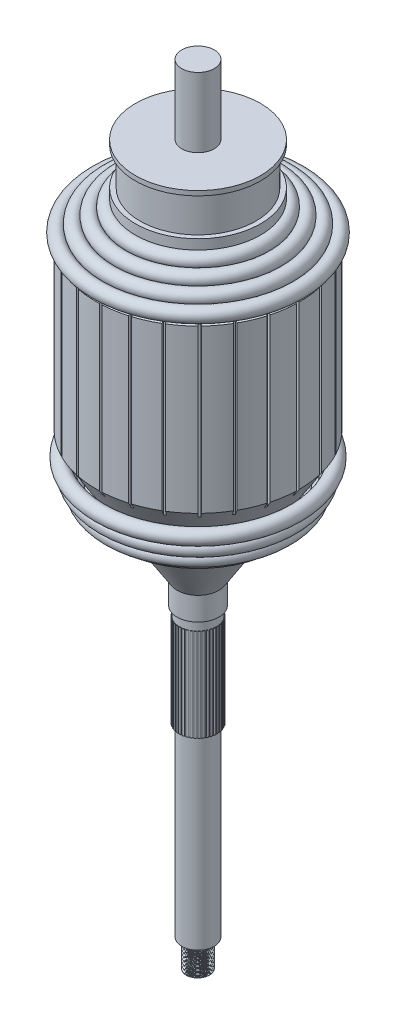
from build123d import *
from build123d.topology import SkipClean

# Parameters (mm, degrees)
CUT_EXTRUDE2_START  = 100
CUT_EXTRUDE2_DEPTH  = 100
SKETCH3_W           = 0.2
SKETCH3_H           = 0.09
BOSS_EXTRUDE1_DEPTH = 20
SKETCH4_W           = 0.373587109
SKETCH4_H           = 0.148348787
BOSS_EXTRUDE2_DEPTH = 20
THREAD1_PITCH       = 0.25
SKETCH5_R           = 1.5


with BuildPart() as part:
    # Sketch1 → Revolve1 (revolve)
    with BuildSketch(Plane.XY, mode=Mode.PRIVATE) as revolve1_sk:
        Polygon((0, 170), (3.5, 170), (3.5, 155), (13.5, 155), (13.5, 154), (12.5, 154), (12.5, 146), (13.5, 146), (13.5, 141), (21.95690767, 135.663267605), (21.95690767, 100.663267605), (4.5, 73), (4.5, 68), (4, 68), (4, 46), (3.5, 46), (3.5, 6), (2.5, 6), (2.5, 0), (0, 0), align=None)
    revolve(revolve1_sk.sketch.rotate(Axis((0, 0, 0), (0, 1, 0)), 90), axis=Axis((0, 0, 0), (0, 1, 0)))

    # Sketch2 → Cut-Extrude2 (cut)
    with BuildSketch(Plane(origin=(0, 180, 0), x_dir=(-1, 0, 0), z_dir=(0, -1, 0)).offset(CUT_EXTRUDE2_START)):
        with BuildLine():
            Line((-20.518018535, 5.08710499), (-21.311651247, 5.283873159))
            ThreePointArc((-21.311651247, 5.283873159), (-21.373157412, 5.029307774), (-21.431622935, 4.774026896))
            Line((-21.431622935, 4.774026896), (-20.633522551, 4.596245087))
            ThreePointArc((-20.633522551, 4.596245087), (-20.577234248, 4.842019463), (-20.518018535, 5.08710499))
        make_face()
        with BuildLine():
            Line((-18.842242826, 9.583193991), (-19.57105688, 9.953869952))
            ThreePointArc((-19.57105688, 9.953869952), (-19.450942387, 10.186590927), (-19.328060714, 10.417862711))
            Line((-19.328060714, 10.417862711), (-18.608295687, 10.029907947))
            ThreePointArc((-18.608295687, 10.029907947), (-18.726601322, 9.807248581), (-18.842242826, 9.583193991))
        make_face()
        with BuildLine():
            Line((-15.867035687, 13.967995572), (-16.480769345, 14.508274751))
            ThreePointArc((-16.480769345, 14.508274751), (-16.306553116, 14.703813109), (-16.130017043, 14.897259635))
            Line((-16.130017043, 14.897259635), (-15.529345184, 14.342494899))
            ThreePointArc((-15.529345184, 14.342494899), (-15.699307162, 14.156252202), (-15.867035687, 13.967995572))
        make_face()
        with BuildLine():
            Line((-11.89484434, 17.47513662), (-12.354934459, 18.15107129))
            ThreePointArc((-12.354934459, 18.15107129), (-12.137563141, 18.297140636), (-11.918465079, 18.440606948))
            Line((-11.918465079, 18.440606948), (-11.47462881, 17.75389015))
            ThreePointArc((-11.47462881, 17.75389015), (-11.685567796, 17.615766434), (-11.89484434, 17.47513662))
        make_face()
        with BuildLine():
            Line((-7.175256178, 19.884250566), (-7.452793603, 20.653369264))
            ThreePointArc((-7.452793603, 20.653369264), (-7.205925435, 20.740791525), (-6.958032121, 20.825263106))
            Line((-6.958032121, 20.825263106), (-6.698919308, 20.049743188))
            ThreePointArc((-6.698919308, 20.049743188), (-6.937581229, 19.968417275), (-7.175256178, 19.884250566))
        make_face()
        with BuildLine():
            Line((-2.004820281, 21.043963919), (-2.082366315, 21.85794009))
            ThreePointArc((-2.082366315, 21.85794009), (-1.821512933, 21.881222203), (-1.560400415, 21.901391394))
            Line((-1.560400415, 21.901391394), (-1.502292068, 21.085797123))
            ThreePointArc((-1.502292068, 21.085797123), (-1.753680918, 21.06637902), (-2.004820281, 21.043963919))
        make_face()
        with BuildLine():
            Line((3.291585847, 20.881407625), (3.418903706, 21.689096152))
            ThreePointArc((3.418903706, 21.689096152), (3.677351926, 21.646775216), (3.935276988, 21.601374712))
            Line((3.935276988, 21.601374712), (3.788729707, 20.796952877))
            ThreePointArc((3.788729707, 20.796952877), (3.540409614, 20.840662694), (3.291585847, 20.881407625))
        make_face()
        with BuildLine():
            Line((8.381169531, 19.406795693), (8.705351434, 20.157446536))
            ThreePointArc((8.705351434, 20.157446536), (8.945155239, 20.052181732), (9.183686465, 19.944064214))
            Line((9.183686465, 19.944064214), (8.841691661, 19.201359596))
            ThreePointArc((8.841691661, 19.201359596), (8.61204319, 19.305450885), (8.381169531, 19.406795693))
        make_face()
        with BuildLine():
            Line((12.944133509, 16.712783415), (13.444809916, 17.35923042))
            ThreePointArc((13.444809916, 17.35923042), (13.65090155, 17.197635922), (13.855051146, 17.033594811))
            Line((13.855051146, 17.033594811), (13.33909761, 16.399274274))
            ThreePointArc((13.33909761, 16.399274274), (13.142550419, 16.557206596), (12.944133509, 16.712783415))
        make_face()
        with BuildLine():
            Line((16.693769974, 12.968645489), (17.339481543, 13.470270014))
            ThreePointArc((17.339481543, 13.470270014), (17.498911513, 13.262499399), (17.655852008, 13.052842001))
            Line((17.655852008, 13.052842001), (16.998358999, 12.566762237))
            ThreePointArc((16.998358999, 12.566762237), (16.84726287, 12.768612124), (16.693769974, 12.968645489))
        make_face()
        with BuildLine():
            Line((19.394475476, 8.409639873), (20.144649775, 8.734923003))
            ThreePointArc((20.144649775, 8.734923003), (20.247400508, 8.494031263), (20.347270755, 8.251931123))
            Line((20.347270755, 8.251931123), (19.589550976, 7.944634312))
            ThreePointArc((19.589550976, 7.944634312), (19.493399835, 8.177718792), (19.394475476, 8.409639873))
        make_face()
        with BuildLine():
            Line((20.876554756, 3.322225654), (21.684055575, 3.450728655))
            ThreePointArc((21.684055575, 3.450728655), (21.723670865, 3.191851904), (21.760195648, 2.932521065))
            Line((21.760195648, 2.932521065), (20.94985942, 2.823315794))
            ThreePointArc((20.94985942, 2.823315794), (20.914694797, 3.072989313), (20.876554756, 3.322225654))
        make_face()
        with BuildLine():
            Line((21.046883322, -1.973936221), (21.860972415, -2.050287665))
            ThreePointArc((21.860972415, -2.050287665), (21.834963088, -2.31088325), (21.80584742, -2.571150077))
            Line((21.80584742, -2.571150077), (20.993811148, -2.475402039))
            ThreePointArc((20.993811148, -2.475402039), (21.021842566, -2.224827387), (21.046883322, -1.973936221))
        make_face()
        with BuildLine():
            Line((19.894758804, -7.146068423), (20.664283959, -7.422476871))
            ThreePointArc((20.664283959, -7.422476871), (20.574284276, -7.66841711), (20.481357603, -7.913266404))
            Line((20.481357603, -7.913266404), (19.718644512, -7.618581257))
            ThreePointArc((19.718644512, -7.618581257), (19.808110654, -7.382849999), (19.894758804, -7.146068423))
        make_face()
        with BuildLine():
            Line((17.492573422, -11.869186865), (18.169182544, -12.328284558))
            ThreePointArc((18.169182544, -12.328284558), (18.020847516, -12.54411612), (17.869948762, -12.7581631))
            Line((17.869948762, -12.7581631), (17.204482922, -12.283056996))
            ThreePointArc((17.204482922, -12.283056996), (17.3497623, -12.076980994), (17.492573422, -11.869186865))
        make_face()
        with BuildLine():
            Line((13.99126532, -15.846520644), (14.532444568, -16.459460785))
            ThreePointArc((14.532444568, -16.459460785), (14.335094631, -16.631622181), (14.135705319, -16.801417487))
            Line((14.135705319, -16.801417487), (13.609300395, -16.17574309))
            ThreePointArc((13.609300395, -16.17574309), (13.801264573, -16.012270856), (13.99126532, -15.846520644))
        make_face()
        with BuildLine():
            Line((9.61083456, -18.828159252), (9.982579653, -19.556428557))
            ThreePointArc((9.982579653, -19.556428557), (9.74861503, -19.674102253), (9.513263524, -19.788977022))
            Line((9.513263524, -19.788977022), (9.158995474, -19.052047756))
            ThreePointArc((9.158995474, -19.052047756), (9.385582635, -18.941450852), (9.61083456, -18.828159252))
        make_face()
        with BuildLine():
            Line((4.62651972, -20.626755369), (4.805472545, -21.424594))
            ThreePointArc((4.805472545, -21.424594), (4.549594093, -21.480386124), (4.293068394, -21.533122352))
            Line((4.293068394, -21.533122352), (4.133197182, -20.731242192))
            ThreePointArc((4.133197182, -20.731242192), (4.380170022, -20.680469829), (4.62651972, -20.626755369))
        make_face()
        with BuildLine():
            Line((-0.64849637, -21.129296586), (-0.673580076, -21.946573407))
            ThreePointArc((-0.673580076, -21.946573407), (-0.935294573, -21.936978336), (-1.196876012, -21.924262411))
            Line((-1.196876012, -21.924262411), (-1.152305089, -21.107816437))
            ThreePointArc((-1.152305089, -21.107816437), (-0.900464782, -21.120058829), (-0.64849637, -21.129296586))
        make_face()
        with BuildLine():
            Line((-5.882765048, -20.304206391), (-6.110309183, -21.089568894))
            ThreePointArc((-6.110309183, -21.089568894), (-6.361415242, -21.01518952), (-6.611616296, -20.937820431))
            Line((-6.611616296, -20.937820431), (-6.365403794, -20.158108947))
            ThreePointArc((-6.365403794, -20.158108947), (-6.124520072, -20.232596859), (-5.882765048, -20.304206391))
        make_face()
        with BuildLine():
            Line((-10.747397963, -18.203328234), (-11.163105093, -18.907429205))
            ThreePointArc((-11.163105093, -18.907429205), (-11.387824794, -18.772939059), (-11.610924413, -18.635778189))
            Line((-11.610924413, -18.635778189), (-11.178540768, -17.941793335))
            ThreePointArc((-11.178540768, -17.941793335), (-10.963749242, -18.073846418), (-10.747397963, -18.203328234))
        make_face()
        with BuildLine():
            Line((-14.936732337, -14.958668017), (-15.514482054, -15.537266202))
            ThreePointArc((-15.514482054, -15.537266202), (-15.698695434, -15.351115794), (-15.880675446, -15.162781467))
            Line((-15.880675446, -15.162781467), (-15.289288914, -14.598128862))
            ThreePointArc((-15.289288914, -14.598128862), (-15.114085725, -14.779449735), (-14.936732337, -14.958668017))
        make_face()
        with BuildLine():
            Line((-18.187536886, -10.774099675), (-18.89102705, -11.190839622))
            ThreePointArc((-18.89102705, -11.190839622), (-19.023159304, -10.964725466), (-19.152585237, -10.73705142))
            Line((-19.152585237, -10.73705142), (-18.439354807, -10.337210265))
            ThreePointArc((-18.439354807, -10.337210265), (-18.314748616, -10.556405871), (-18.187536886, -10.774099675))
        make_face()
        with BuildLine():
            Line((-20.295551602, -5.912555026), (-21.08057934, -6.141251431))
            ThreePointArc((-21.08057934, -6.141251431), (-21.152328112, -5.889381112), (-21.221067659, -5.636672944))
            Line((-21.221067659, -5.636672944), (-20.430808223, -5.426766729))
            ThreePointArc((-20.430808223, -5.426766729), (-20.364628495, -5.670064202), (-20.295551602, -5.912555026))
        make_face()
        with BuildLine():
            Line((-21.12832217, -0.679502799), (-21.945561301, -0.705785827))
            ThreePointArc((-21.945561301, -0.705785827), (-21.952418352, -0.443985283), (-21.956152354, -0.182121577))
            Line((-21.956152354, -0.182121577), (-21.138518819, -0.175339482))
            ThreePointArc((-21.138518819, -0.175339482), (-21.134923869, -0.427451546), (-21.12832217, -0.679502799))
        make_face()
    extrude(amount=-CUT_EXTRUDE2_DEPTH, mode=Mode.SUBTRACT)

    # Sketch3 → Boss-Extrude1 (add)
    with BuildSketch(Plane.XZ.offset(-46)):
        Polygon((-0.031634172, 3.915857211), (0.166788768, 3.890790564), (0.178068759, 3.980080888), (-0.020354181, 4.005147534), align=None)
        with Locations((-0.421844554, 3.920813695)):
            Rectangle(SKETCH3_W, SKETCH3_H)
        Polygon((0.459729539, 3.89414532), (0.653446171, 3.844407343), (0.675828261, 3.931579827), (0.482111628, 3.981317805), align=None)
        Polygon((0.944497478, 3.811020431), (1.130452775, 3.737395521), (1.163583985, 3.821075404), (0.977628688, 3.894700315), align=None)
        Polygon((1.415024566, 3.667793474), (1.590285902, 3.571442739), (1.633643733, 3.65031034), (1.458382397, 3.746661075), align=None)
        Polygon((1.86389031, 3.466723222), (2.025693709, 3.349166171), (2.078594382, 3.421977701), (1.916790983, 3.539534751), align=None)
        Polygon((2.284015829, 3.210980674), (2.429809554, 3.074071253), (2.491418794, 3.139678429), (2.345625068, 3.27658785), align=None)
        Polygon((2.668775492, 2.904599042), (2.79626029, 2.750496394), (2.865606482, 2.807864553), (2.738121684, 2.961967202), align=None)
        Polygon((3.012101409, 2.552410149), (3.119266768, 2.383544564), (3.195256281, 2.431768976), (3.088090922, 2.600634561), align=None)
        Polygon((3.308579126, 2.159968223), (3.393734985, 1.979002812), (3.475169419, 2.017322949), (3.390013561, 2.198288359), align=None)
        Polygon((3.553533013, 1.733462308), (3.615336412, 1.543251004), (3.700931498, 1.571062534), (3.639128099, 1.761273837), align=None)
        Polygon((3.743099999, 1.279618656), (3.780576262, 1.083161206), (3.868982114, 1.100025524), (3.831505852, 1.296482975), align=None)
        Polygon((3.874290501, 0.805594654), (3.886848604, 0.605989309), (3.97667101, 0.611640455), (3.964112906, 0.811245801), align=None)
        Polygon((3.945035565, 0.318865943), (3.932477461, 0.119260598), (4.022299867, 0.113609451), (4.03485797, 0.313214796), align=None)
        Polygon((3.9542195, -0.172891474), (3.916743237, -0.369348924), (4.00514909, -0.386213243), (4.042625353, -0.189755792), align=None)
        Polygon((3.90169747, -0.66192229), (3.839894071, -0.852133593), (3.925489157, -0.879945122), (3.987292556, -0.689733819), align=None)
        Polygon((3.788297778, -1.140514195), (3.70314192, -1.321479606), (3.784576355, -1.359799742), (3.869732213, -1.178834332), align=None)
        Polygon((3.615808806, -1.601119511), (3.508643447, -1.769985096), (3.58463296, -1.818209507), (3.691798319, -1.649343922), align=None)
        Polygon((3.386950807, -2.036474215), (3.259466009, -2.190576864), (3.328812201, -2.247945023), (3.456296999, -2.093842374), align=None)
        Polygon((3.105333009, -2.439712505), (2.959539283, -2.576621926), (3.021148523, -2.642229102), (3.166942248, -2.505319681), align=None)
        Polygon((2.775396693, -2.80447507), (2.613593294, -2.922032121), (2.666493966, -2.99484365), (2.828297365, -2.8772866), align=None)
        Polygon((2.402345151, -3.125009389), (2.227083815, -3.221360124), (2.270441646, -3.300227725), (2.445702982, -3.20387699), align=None)
        Polygon((1.992061629, -3.396260443), (1.806106332, -3.469885353), (1.839237542, -3.553565237), (2.025192839, -3.479940326), align=None)
        Polygon((1.551016544, -3.613950441), (1.357299912, -3.663688418), (1.379682002, -3.750860902), (1.573398634, -3.701122925), align=None)
        Polygon((1.08616544, -3.774646281), (0.8877425, -3.799712928), (0.899022491, -3.889003251), (1.097445431, -3.863936604), align=None)
        with Locations((0.504839296, -3.920813695)):
            Rectangle(SKETCH3_W, SKETCH3_H)
        Polygon((0.114628914, -3.915857211), (-0.083794026, -3.890790564), (-0.095074017, -3.980080888), (0.103348923, -4.005147534), align=None)
        Polygon((-0.376734797, -3.89414532), (-0.570451429, -3.844407343), (-0.592833519, -3.931579827), (-0.399116886, -3.981317805), align=None)
        Polygon((-0.861502736, -3.811020431), (-1.047458033, -3.737395521), (-1.080589243, -3.821075404), (-0.894633946, -3.894700315), align=None)
        Polygon((-1.332029824, -3.667793474), (-1.50729116, -3.571442739), (-1.550648991, -3.65031034), (-1.375387655, -3.746661075), align=None)
        Polygon((-1.780895568, -3.466723222), (-1.942698967, -3.349166171), (-1.99559964, -3.421977701), (-1.833796241, -3.539534751), align=None)
        Polygon((-2.201021087, -3.210980674), (-2.346814812, -3.074071253), (-2.408424052, -3.139678429), (-2.262630326, -3.27658785), align=None)
        Polygon((-2.58578075, -2.904599042), (-2.713265548, -2.750496394), (-2.782611739, -2.807864553), (-2.655126942, -2.961967202), align=None)
        Polygon((-2.929106667, -2.552410149), (-3.036272026, -2.383544564), (-3.112261539, -2.431768976), (-3.00509618, -2.600634561), align=None)
        Polygon((-3.225584384, -2.159968223), (-3.310740243, -1.979002812), (-3.392174677, -2.017322949), (-3.307018819, -2.198288359), align=None)
        Polygon((-3.470538271, -1.733462308), (-3.53234167, -1.543251004), (-3.617936756, -1.571062534), (-3.556133357, -1.761273837), align=None)
        Polygon((-3.660105257, -1.279618656), (-3.69758152, -1.083161206), (-3.785987372, -1.100025524), (-3.74851111, -1.296482975), align=None)
        Polygon((-3.791295759, -0.805594654), (-3.803853862, -0.605989309), (-3.893676268, -0.611640455), (-3.881118164, -0.811245801), align=None)
        Polygon((-3.862040823, -0.318865943), (-3.849482719, -0.119260598), (-3.939305125, -0.113609451), (-3.951863228, -0.313214796), align=None)
        Polygon((-3.871224758, 0.172891474), (-3.833748495, 0.369348924), (-3.922154348, 0.386213243), (-3.959630611, 0.189755792), align=None)
        Polygon((-3.818702728, 0.66192229), (-3.756899329, 0.852133593), (-3.842494415, 0.879945122), (-3.904297814, 0.689733819), align=None)
        Polygon((-3.705303036, 1.140514195), (-3.620147178, 1.321479606), (-3.701581613, 1.359799742), (-3.786737471, 1.178834332), align=None)
        Polygon((-3.532814064, 1.601119511), (-3.425648705, 1.769985096), (-3.501638218, 1.818209507), (-3.608803577, 1.649343922), align=None)
        Polygon((-3.303956065, 2.036474215), (-3.176471267, 2.190576864), (-3.245817459, 2.247945023), (-3.373302257, 2.093842374), align=None)
        Polygon((-3.022338267, 2.439712505), (-2.876544541, 2.576621926), (-2.938153781, 2.642229102), (-3.083947506, 2.505319681), align=None)
        Polygon((-2.692401951, 2.80447507), (-2.530598552, 2.922032121), (-2.583499224, 2.99484365), (-2.745302623, 2.8772866), align=None)
        Polygon((-2.319350409, 3.125009389), (-2.144089073, 3.221360124), (-2.187446903, 3.300227725), (-2.36270824, 3.20387699), align=None)
        Polygon((-1.909066887, 3.396260443), (-1.72311159, 3.469885353), (-1.7562428, 3.553565237), (-1.942198097, 3.479940326), align=None)
        Polygon((-1.468021802, 3.613950441), (-1.27430517, 3.663688418), (-1.29668726, 3.750860902), (-1.490403892, 3.701122925), align=None)
        Polygon((-1.003170698, 3.774646281), (-0.804747758, 3.799712928), (-0.816027749, 3.889003251), (-1.014450689, 3.863936604), align=None)
    extrude(amount=-BOSS_EXTRUDE1_DEPTH)

    # Sketch4 → Boss-Extrude2 (add)
    with BuildSketch(Plane.XZ.offset(-46)):
        Polygon((0.090718378, 4.146030918), (0.459927205, 4.089003113), (0.437281869, 3.942392911), (0.068073041, 3.999420716), align=None)
        with Locations((-0.356439901, 4.037114895)):
            Rectangle(SKETCH4_W, SKETCH4_H)
        Polygon((0.722543849, 4.083593097), (1.078720451, 3.970874171), (1.033960566, 3.829438972), (0.677783964, 3.942157899), align=None)
        Polygon((1.337433504, 3.925439315), (1.672229405, 3.759671304), (1.606404105, 3.62672623), (1.271608204, 3.792494242), align=None)
        Polygon((1.920974852, 3.675276563), (2.226542718, 3.460344928), (2.141194892, 3.339006099), (1.835627027, 3.553937734), align=None)
        Polygon((2.459490178, 3.338968443), (2.728667757, 3.079910999), (2.625797887, 2.973022495), (2.356620307, 3.232079938), align=None)
        Polygon((2.940357138, 2.924397733), (3.166835137, 2.627286567), (3.048854404, 2.537353763), (2.822376405, 2.834464928), align=None)
        Polygon((3.352304619, 2.441281618), (3.530774585, 2.113080765), (3.400448358, 2.04221161), (3.221978392, 2.370412462), align=None)
        Polygon((3.685676921, 1.900943932), (3.81195567, 1.549346141), (3.672338685, 1.499201747), (3.546059936, 1.850799538), align=None)
        Polygon((3.93266008, 1.31604973), (4.003787744, 0.949296157), (3.858152505, 0.921051866), (3.787024841, 1.28780544), align=None)
        Polygon((4.08746502, 0.700308439), (4.101774427, 0.326995475), (3.953534501, 0.321313311), (3.939225094, 0.694626275), align=None)
        Polygon((4.146463244, 0.068152511), (4.103618994, -0.302969704), (3.956248999, -0.285956557), (3.999093249, 0.085165658), align=None)
        Polygon((4.108271884, -0.565600853), (4.00927821, -0.92583353), (3.866232374, -0.886523845), (3.965226047, -0.526291169), align=None)
        Polygon((3.973786113, -1.186097013), (3.820963343, -1.526996602), (3.685594538, -1.466311766), (3.838417308, -1.125412177), align=None)
        Polygon((3.746158164, -1.778792065), (3.543088334, -2.092368168), (3.418569491, -2.011730582), (3.621639321, -1.698154478), align=None)
        Polygon((3.430723442, -2.329793738), (3.182166337, -2.608696398), (3.071416072, -2.509996138), (3.319973177, -2.231093477), align=None)
        Polygon((3.034875471, -2.82618702), (2.746657058, -3.063878996), (2.652271263, -2.949429511), (2.940489676, -2.711737536), align=None)
        Polygon((2.56789259, -3.256336875), (2.246768465, -3.447246866), (2.170959464, -3.319730757), (2.492083589, -3.128820766), align=None)
        Polygon((2.040720484, -3.610160952), (1.694217524, -3.749814192), (1.638762215, -3.612220328), (1.985265175, -3.472567088), align=None)
        Polygon((1.46571562, -3.879365917), (1.101955561, -3.964489051), (1.068153769, -3.820042516), (1.431913828, -3.734919382), align=None)
        Polygon((0.856355624, -4.057641833), (0.483864693, -4.086239647), (0.472508704, -3.938326144), (0.844999635, -3.90972833), align=None)
        Polygon((0.226923377, -4.140810063), (-0.145567554, -4.112212249), (-0.134211565, -3.964298746), (0.238279366, -3.992896561), align=None)
        Polygon((-0.407827761, -4.126921215), (-0.77158782, -4.041798081), (-0.737786028, -3.897351546), (-0.374025969, -3.98247468), align=None)
        Polygon((-1.033019762, -4.016300831), (-1.379522722, -3.876647592), (-1.324067413, -3.739053728), (-0.977564453, -3.878706968), align=None)
        Polygon((-1.633998655, -3.81154176), (-1.95512278, -3.620631769), (-1.879313779, -3.49311566), (-1.558189654, -3.684025652), align=None)
        Polygon((-2.196678005, -3.517443381), (-2.484896418, -3.279751406), (-2.390510623, -3.165301922), (-2.10229221, -3.402993897), align=None)
        Polygon((-2.707869084, -3.14089911), (-2.956426189, -2.86199645), (-2.845675924, -2.763296189), (-2.597118819, -3.04219885), align=None)
        Polygon((-3.155590007, -2.690734826), (-3.358659837, -2.377158723), (-3.234140994, -2.296521136), (-3.031071164, -2.61009724), align=None)
        Polygon((-3.529346574, -2.177501999), (-3.682169344, -1.83660241), (-3.546800539, -1.775917574), (-3.39397777, -2.116817162), align=None)
        Polygon((-3.82037825, -1.61323037), (-3.919371923, -1.252997693), (-3.776326087, -1.213688009), (-3.677332413, -1.573920685), align=None)
        Polygon((-4.021863497, -1.011145988), (-4.064707746, -0.640023773), (-3.917337751, -0.623010625), (-3.874493502, -0.994132841), align=None)
        Polygon((-4.129079672, -0.385361202), (-4.114770265, -0.012048237), (-3.966530339, -0.017730401), (-3.980839746, -0.391043366), align=None)
        Polygon((-4.13951372, 0.249456125), (-4.068386056, 0.616209699), (-3.922750817, 0.587965409), (-3.993878481, 0.221211835), align=None)
        Polygon((-4.052921075, 0.878426411), (-3.926642326, 1.230024202), (-3.787025341, 1.179879808), (-3.91330409, 0.828282017), align=None)
        Polygon((-3.871331394, 1.486807127), (-3.692861428, 1.81500798), (-3.562535201, 1.744138824), (-3.741005167, 1.415937971), align=None)
        Polygon((-3.599000987, 2.060338344), (-3.372522988, 2.357449509), (-3.254542255, 2.267516704), (-3.481020254, 1.970405539), align=None)
        Polygon((-3.242313047, 2.585576976), (-2.973135468, 2.84463442), (-2.870265597, 2.737745915), (-3.139443177, 2.478688472), align=None)
        Polygon((-2.809628038, 3.050211876), (-2.504060172, 3.265143511), (-2.418712346, 3.143804682), (-2.724280212, 2.928873047), align=None)
        Polygon((-2.311087728, 3.443352394), (-1.976291828, 3.609120406), (-1.910466528, 3.476175332), (-2.245262429, 3.31040732), align=None)
        Polygon((-1.758377481, 3.755783651), (-1.402200879, 3.868502577), (-1.357440994, 3.727067378), (-1.713617596, 3.614348452), align=None)
        Polygon((-1.164452356, 3.980182522), (-0.795243529, 4.037210327), (-0.772598193, 3.890600124), (-1.14180702, 3.833572319), align=None)
    extrude(amount=-BOSS_EXTRUDE2_DEPTH)

    # Thread1: the profile of Thread Profile1 profile screwed along a right-hand helix of 24 turns, 6 arcs to a turn; built about Z, then put on its axis
    with SkipClean():  # the faces are left unmerged after this step: merging them gives an invalid solid
        thread1_z = Axis((0, 0, 0), (0, 0, 1))
        thread1_corners = [(2.5003, 0, -0.000173205), (2.5003, 0, 0.218923204), (2.364683531, 0, 0.140625), (2.364683531, 0, 0.078125)]
        with BuildLine(mode=Mode.PRIVATE) as thread1_profile:
            Line(thread1_corners[0], thread1_corners[1])
            Line(thread1_corners[1], thread1_corners[2])
            Line(thread1_corners[2], thread1_corners[3])
            Line(thread1_corners[3], thread1_corners[0])
        thread1_cap = Face(thread1_profile.wire())
        thread1_turn_angles = [0, 30, 60, 90, 120, 150, 180, 210, 240, 270, 300, 330, 360]
        thread1_turn_weights = [1, 0.8660254037844387, 1, 0.8660254037844387, 1, 0.8660254037844387, 1, 0.8660254037844387, 1, 0.8660254037844387, 1, 0.8660254037844387, 1]
        thread1_turn_rails = [Edge.make_bspline([Vector(p[0], p[1], 0).rotate(thread1_z, thread1_turn_angles[k]) / thread1_turn_weights[k] + Vector(0, 0, p[2] + THREAD1_PITCH * thread1_turn_angles[k] / 360) for k in range(13)], [0, 0, 0, 1, 1, 2, 2, 3, 3, 4, 4, 5, 5, 6, 6, 6], 2, thread1_turn_weights) for p in thread1_corners]
        thread1_turn_sides = [Face.make_surface_from_curves(thread1_turn_rails[p[0]], thread1_turn_rails[p[1]]) for p in [(0, 1), (1, 2), (2, 3), (3, 0)]]
        thread1 = Plane(origin=(0, 6, 0), x_dir=(-1, 0, 0), z_dir=(0, -1, 0)) * Solid(Shell([*[p.moved(Location((0, 0, THREAD1_PITCH * i))) for i in range(24) for p in thread1_turn_sides], thread1_cap, thread1_cap.rotate(thread1_z, 8640).moved(Location((0, 0, THREAD1_PITCH * 8640 / 360)))]))
        add(thread1, mode=Mode.SUBTRACT)


with BuildPart() as body_2:
    # Sketch5 → Revolve2 (revolve)
    with BuildSketch(Plane(origin=(0, 0, 0), x_dir=(0, 0, -1), z_dir=(1, 0, 0)), mode=Mode.PRIVATE) as revolve2_sk:
        with Locations((21.598295846, 137.663267605)):
            Circle(SKETCH5_R)
        with Locations((19.061223545, 139.264287324)):
            Circle(SKETCH5_R)
        with Locations((16.524151244, 140.865307042)):
            Circle(SKETCH5_R)
        with Locations((13.987078943, 142.466326761)):
            Circle(SKETCH5_R)
        with Locations((21.106842858, 95.742884868)):
            Circle(SKETCH5_R)
        with Locations((20.051319764, 92.934705565)):
            Circle(SKETCH5_R)
        with Locations((18.813729364, 90.201873701)):
            Circle(SKETCH5_R)
        with Locations((16.480384316, 88.316270113)):
            Circle(SKETCH5_R)
    revolve(revolve2_sk.sketch.rotate(Axis((0, 0, 0), (0, -1, 0)), 178.242040636), axis=Axis((0, 0, 0), (0, -1, 0)))


solid = Compound([part.part, body_2.part])
